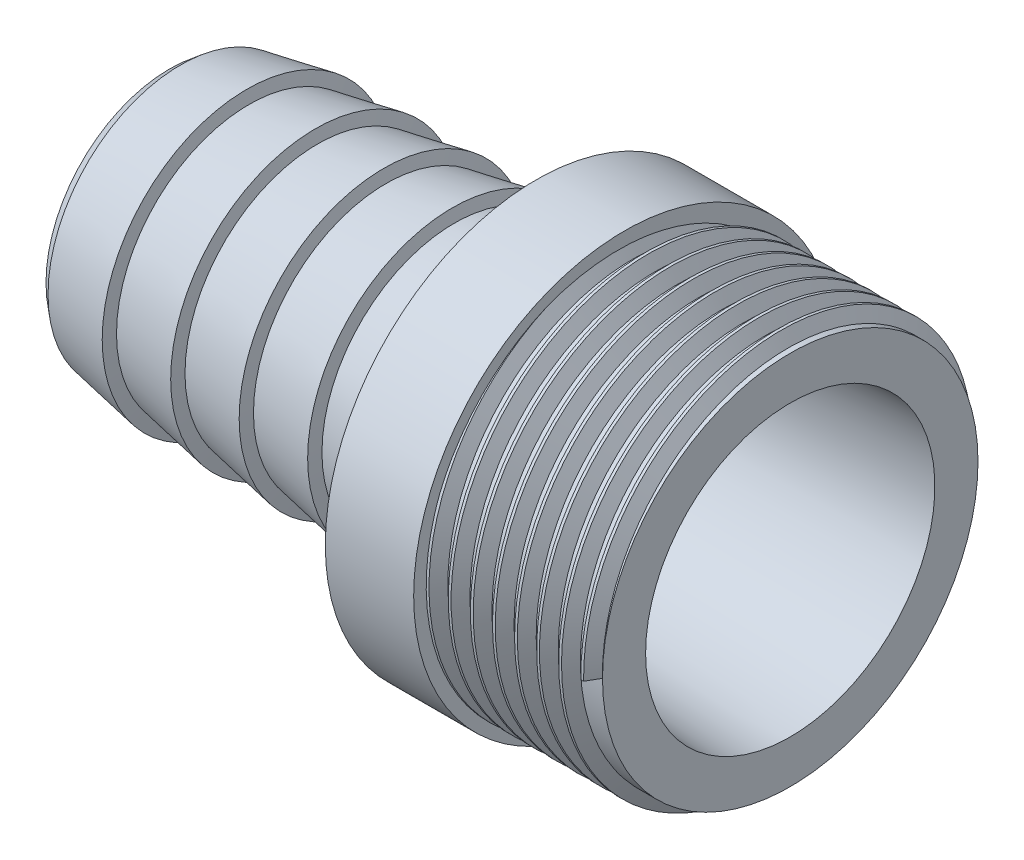
from build123d import *

# Parameters (mm, degrees)
THREAD1_PITCH = 2


with BuildPart() as part:
    # Sketch1 → Revolve2 (revolve)
    with BuildSketch(Plane(origin=(0, 0, 0), x_dir=(1, 0, 0), z_dir=(0, 1, 0)), mode=Mode.PRIVATE) as revolve2_sk:
        Polygon((0, 10.095412493), (0, 11.183615724), (1, 12), (7, 13.095445115), (7.2, 12), (13.2, 13.095445115), (13.4, 12), (19.4, 13.095445115), (19.6, 12), (25.6, 13.095445115), (25.8, 12), (31.8, 13.095445115), (33.2, 13.095445115), (33.2, 19.095445115), (41.2, 19.095445115), (41.2, 17), (56.2, 17), (56.2, 13.095445115), align=None)
    revolve(revolve2_sk.sketch.rotate(Axis((0, 0, 0), (1, 0, 0)), 180), axis=Axis((0, 0, 0), (1, 0, 0)))

    # Thread1: the profile of Thread Profile2 profile screwed along a right-hand helix of 7.5 turns, 10 arcs to a turn; built about Z, then put on its axis
    thread1_z = Axis((0, 0, 0), (0, 0, 1))
    thread1_corners = [(16.9997, 0, -0.000173205), (18.08253175, 0, 0.624999997), (18.08253175, 0, 0.874999997), (16.9997, 0, 1.5001732)]
    with BuildLine(mode=Mode.PRIVATE) as thread1_profile:
        Line(thread1_corners[0], thread1_corners[1])
        Line(thread1_corners[1], thread1_corners[2])
        Line(thread1_corners[2], thread1_corners[3])
        Line(thread1_corners[3], thread1_corners[0])
    thread1_cap = Face(thread1_profile.wire())
    thread1_turn_angles = [0, 18, 36, 54, 72, 90, 108, 126, 144, 162, 180, 198, 216, 234, 252, 270, 288, 306, 324, 342, 360]
    thread1_turn_weights = [1, 0.9510565162951535, 1, 0.9510565162951535, 1, 0.9510565162951535, 1, 0.9510565162951535, 1, 0.9510565162951535, 1, 0.9510565162951535, 1, 0.9510565162951535, 1, 0.9510565162951535, 1, 0.9510565162951535, 1, 0.9510565162951535, 1]
    thread1_turn_rails = [Edge.make_bspline([Vector(p[0], p[1], 0).rotate(thread1_z, thread1_turn_angles[k]) / thread1_turn_weights[k] + Vector(0, 0, p[2] + THREAD1_PITCH * thread1_turn_angles[k] / 360) for k in range(21)], [0, 0, 0, 1, 1, 2, 2, 3, 3, 4, 4, 5, 5, 6, 6, 7, 7, 8, 8, 9, 9, 10, 10, 10], 2, thread1_turn_weights) for p in thread1_corners]
    thread1_turn_sides = [Face.make_surface_from_curves(thread1_turn_rails[p[0]], thread1_turn_rails[p[1]]) for p in [(0, 1), (1, 2), (2, 3), (3, 0)]]
    thread1_last_angles = [2520, 2538, 2556, 2574, 2592, 2610, 2628, 2646, 2664, 2682, 2700]
    thread1_last_weights = [1, 0.9510565162951535, 1, 0.9510565162951535, 1, 0.9510565162951535, 1, 0.9510565162951535, 1, 0.9510565162951535, 1]
    thread1_last_rails = [Edge.make_bspline([Vector(p[0], p[1], 0).rotate(thread1_z, thread1_last_angles[k]) / thread1_last_weights[k] + Vector(0, 0, p[2] + THREAD1_PITCH * thread1_last_angles[k] / 360) for k in range(11)], [0, 0, 0, 1, 1, 2, 2, 3, 3, 4, 4, 5, 5, 5], 2, thread1_last_weights) for p in thread1_corners]
    thread1_last_sides = [Face.make_surface_from_curves(thread1_last_rails[p[0]], thread1_last_rails[p[1]]) for p in [(0, 1), (1, 2), (2, 3), (3, 0)]]
    thread1 = Plane(origin=(56.2, 0, 0), x_dir=(0, 0, 1), z_dir=(-1, 0, 0)) * Solid(Shell([*[p.moved(Location((0, 0, THREAD1_PITCH * i))) for i in range(7) for p in thread1_turn_sides], *thread1_last_sides, thread1_cap, thread1_cap.rotate(thread1_z, 2700).moved(Location((0, 0, THREAD1_PITCH * 2700 / 360)))]))
    add(thread1)


solid = part.part
